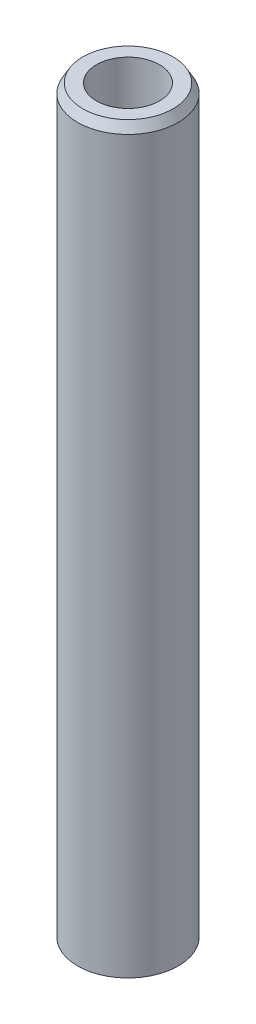
from build123d import *
from OCP.BRepFilletAPI import BRepFilletAPI_MakeChamfer

# Parameters (mm, degrees)
SKETCH1_R           = 12.5
BOSS_EXTRUDE1_DEPTH = 184.882599877
SKETCH2_R           = 7.814979519
CUT_EXTRUDE1_DEPTH  = 186.725807946
CHAMFER1_SIZE       = 2.270217583
CHAMFER1_SIZE2      = 1.310710732


with BuildPart() as part:
    # Sketch1 → Boss-Extrude1 (new body)
    with BuildSketch(Plane(origin=(0, 0, 0), x_dir=(1, 0, 0), z_dir=(0, 1, 0))):
        Circle(SKETCH1_R)
    extrude(amount=BOSS_EXTRUDE1_DEPTH)

    # Sketch2 → Cut-Extrude1 (cut, through all)
    with BuildSketch(Plane(origin=(0, 0, 0), x_dir=(1, 0, 0), z_dir=(0, 1, 0))):
        Circle(SKETCH2_R)
    extrude(amount=CUT_EXTRUDE1_DEPTH, mode=Mode.SUBTRACT)

    # Chamfer1: one chamfer whose edges measure the first distance from different faces: ONE call of the kernel's chamfer builder (chamfer() names one face for all edges)
    chamfer1_edges_1 = [part.edges().sort_by_distance(p)[0] for p in [
        (-12.5, 184.882599877, 0),
    ]]
    chamfer1_side_1 = [part.faces().sort_by_distance(p)[0] for p in [
        (-12.5, 92.441299938, 0),
    ]]
    chamfer1_edges_2 = [part.edges().sort_by_distance(p)[0] for p in [
        (-12.5, 0, 0),
    ]]
    chamfer1_side_2 = [part.faces().sort_by_distance(p)[0] for p in [
        (-12.146446609, 0, 0),
    ]]
    chamfer1 = BRepFilletAPI_MakeChamfer(part.part.solid().wrapped)
    for e in chamfer1_edges_1:
        chamfer1.Add(CHAMFER1_SIZE, CHAMFER1_SIZE2, e.wrapped, chamfer1_side_1[0].wrapped)  # the first distance lies on this face
    for e in chamfer1_edges_2:
        chamfer1.Add(CHAMFER1_SIZE, CHAMFER1_SIZE2, e.wrapped, chamfer1_side_2[0].wrapped)  # the first distance lies on this face
    add(Compound.cast(chamfer1.Shape()), mode=Mode.REPLACE)


solid = part.part
